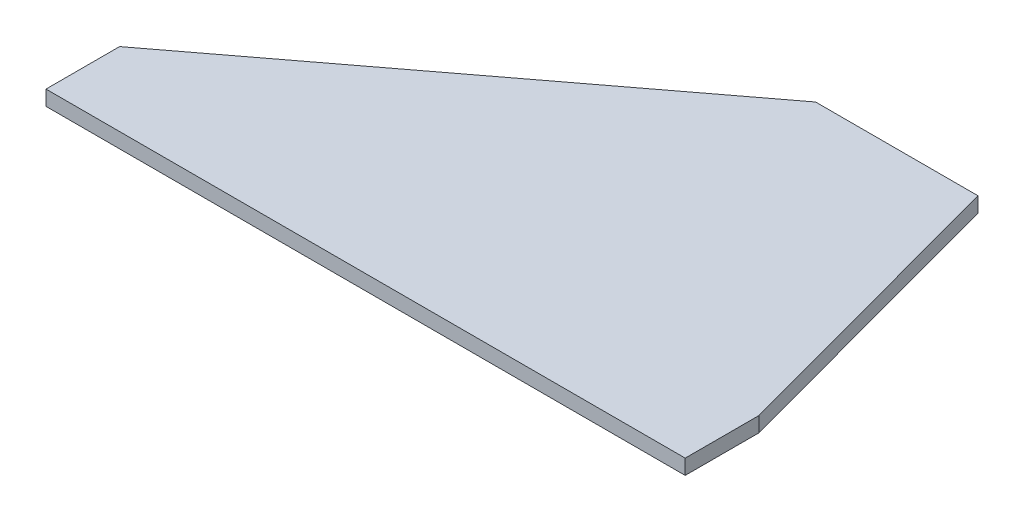
from build123d import *

# Parameters (mm, degrees)
BOSS_EXTRUDE1_DEPTH      = 2.38125
BOSS_EXTRUDE1_DEPTH_BACK = 2.38125


with BuildPart() as part:
    # Sketch1 → Boss-Extrude1 (new, two sides: drawn at the far end of the back side and taken through both)
    with BuildSketch(Plane(origin=(0, 0, 0), x_dir=(1, 0, 0), z_dir=(0, 1, 0)).offset(-BOSS_EXTRUDE1_DEPTH_BACK)):
        Polygon((0, 0), (0, 23.368), (125.73, 118.618), (177.292, 118.618), (202.946, 23.368), (202.946, 0), align=None)
    extrude(amount=BOSS_EXTRUDE1_DEPTH + BOSS_EXTRUDE1_DEPTH_BACK)


solid = part.part
